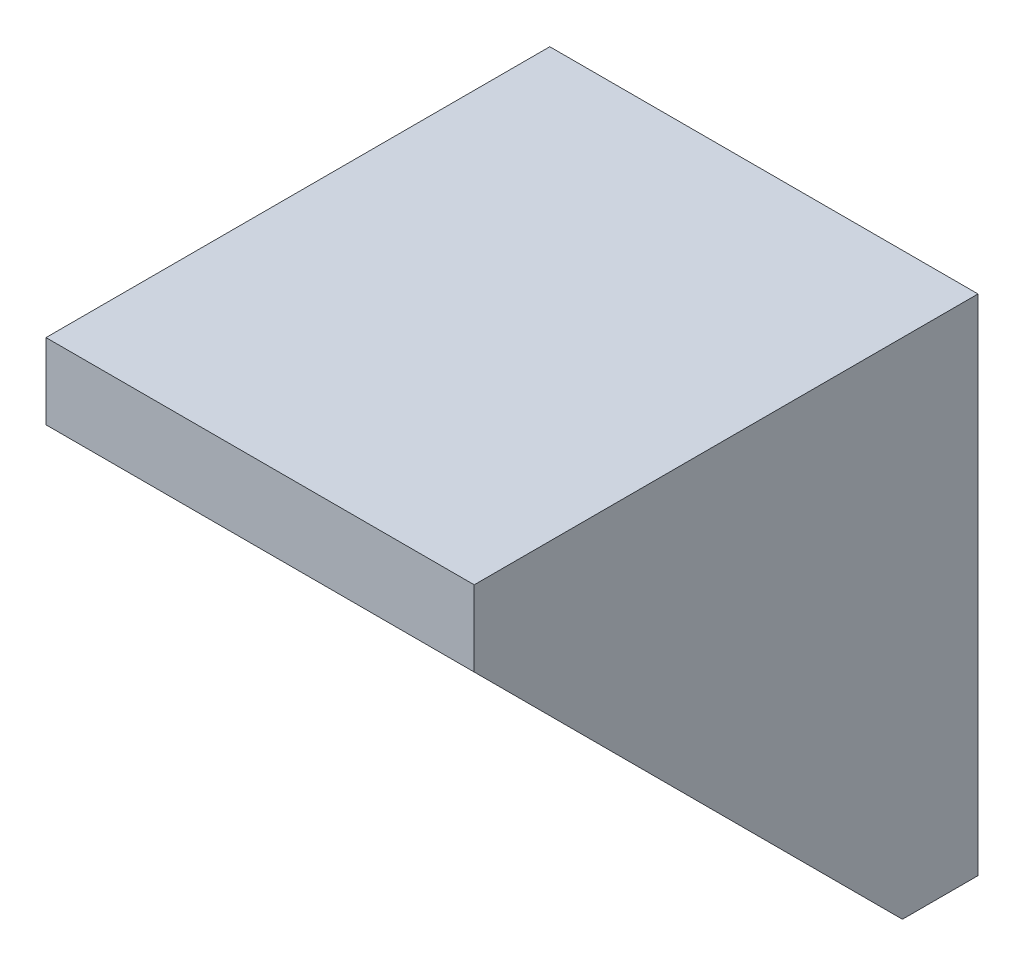
from build123d import *

# Parameters (mm, degrees)
BOSS_EXTRUDE1_DEPTH = 8.5
SKETCH2_W           = 17
SKETCH2_H           = 17
CUT_EXTRUDE1_DEPTH  = 6
CUT_EXTRUDE2_REACH  = 29.591


with BuildPart() as part:
    # Sketch1 → Boss-Extrude1 (new, symmetric)
    with BuildSketch(Plane(origin=(0, 0, 0), x_dir=(0, 0, -1), z_dir=(1, 0, 0))):
        Polygon((0, 0), (-20, 0), (-20, -3), (-11.5, -11.5), (-3, -20), (0, -20), align=None)
    extrude(amount=BOSS_EXTRUDE1_DEPTH, both=True)

    # Sketch2 → Cut-Extrude1 (cut, symmetric)
    with BuildSketch(Plane(origin=(0, 0, 0), x_dir=(0, 0, -1), z_dir=(1, 0, 0))):
        with Locations((-11.5, -11.5)):
            Rectangle(SKETCH2_W, SKETCH2_H)
    extrude(amount=CUT_EXTRUDE1_DEPTH, both=True, mode=Mode.SUBTRACT)

    # Sketch3 → Cut-Extrude2 (cut, up to next)
    with BuildSketch(Plane.XY.offset(3), mode=Mode.PRIVATE) as cut_extrude2_sk1:
        with BuildLine():
            Line((-3, -9), (-3, -12))
            ThreePointArc((-3, -12), (0, -15), (3, -12))
            Line((3, -12), (3, -9))
            ThreePointArc((3, -9), (0, -6), (-3, -9))
        make_face()
    cut_extrude2_tool1 = extrude(cut_extrude2_sk1.sketch, amount=-CUT_EXTRUDE2_REACH, mode=Mode.PRIVATE) & part.part
    add(cut_extrude2_tool1.solids().sort_by_distance((0, -10.5, 3))[0], mode=Mode.SUBTRACT)


solid = part.part
